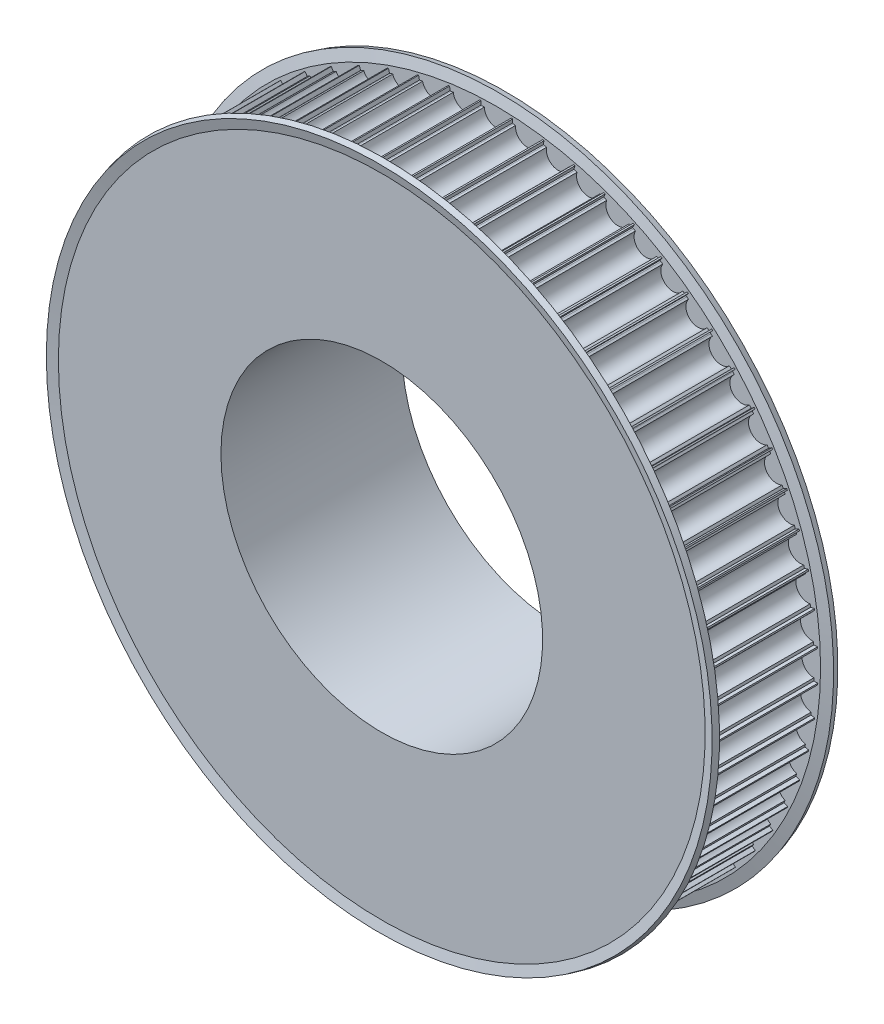
from build123d import *

# Parameters (mm, degrees)
CUT_EXTRUDE1_DEPTH = 122.757956619
CIRPATTERN1_COUNT  = 64


with BuildPart() as part:
    # Sketch1 → Revolve1 (revolve)
    with BuildSketch(Plane(origin=(0, 0, 0), x_dir=(0, 0, -1), z_dir=(1, 0, 0))):
        Polygon((0, 40), (0, 80), (30, 80), (30, 55.5), (45, 55.5), (45, 40), align=None)
    revolve(axis=Axis((0, 0, -88.99), (0, 0, 1)))

    # Sketch3 → Cut-Extrude1 (cut, through all)
    with BuildSketch(Plane.XY):
        with BuildLine():
            ThreePointArc((2.930117458, 78.356251848), (2.979381341, 78.648877767), (2.999494674, 78.944939099))
            Line((2.999494674, 78.944939099), (3.638910237, 78.944939099))
            ThreePointArc((3.638910237, 78.944939099), (3.662646822, 78.94531481), (3.686383408, 78.944939099))
            Line((3.686383408, 78.944939099), (3.686383408, 79.915020975))
            ThreePointArc((3.686383408, 79.915020975), (-0.063686599, 79.99997465), (-3.813616592, 79.909050354))
            Line((-3.813616592, 79.909050354), (-3.813616592, 78.944939099))
            ThreePointArc((-3.813616592, 78.944939099), (-3.665768236, 78.959656253), (-3.51791988, 78.944939099))
            Line((-3.51791988, 78.944939099), (-2.999494674, 78.944939099))
            ThreePointArc((-2.999494674, 78.944939099), (-2.980062768, 78.654708969), (-2.932614589, 78.367725002))
            ThreePointArc((-2.932614589, 78.367725002), (-0.00587088, 76.000005745), (2.930117458, 78.356251848))
        make_face()
    cut_extrude1 = extrude(amount=-CUT_EXTRUDE1_DEPTH, mode=Mode.SUBTRACT)

    # CirPattern1: Cut-Extrude1 ×64 about axis
    cirpattern1_axis = Axis((0, 0, -88.99), (0, 0, 1))
    for i in range(1, CIRPATTERN1_COUNT):
        add(cut_extrude1.rotate(cirpattern1_axis, i * 360 / CIRPATTERN1_COUNT), mode=Mode.SUBTRACT)

    # Sketch4 → Revolve2 (revolve)
    with BuildSketch(Plane(origin=(0, 0, 0), x_dir=(0, 0, -1), z_dir=(1, 0, 0))):
        Polygon((0, 75.615020975), (1.5, 75.615020975), (1.5, 80.615020975), (0.815526601, 83.169510475), (-0.633362138, 82.781281908), (0, 80.417542228), align=None)
        Polygon((29.184473399, 83.169510475), (30.633362138, 82.781281908), (30, 80.417542228), (30, 75.615020975), (28.5, 75.615020975), (28.5, 80.615020975), align=None)
    revolve(axis=Axis((0, 0, -88.99), (0, 0, 1)))


solid = part.part
